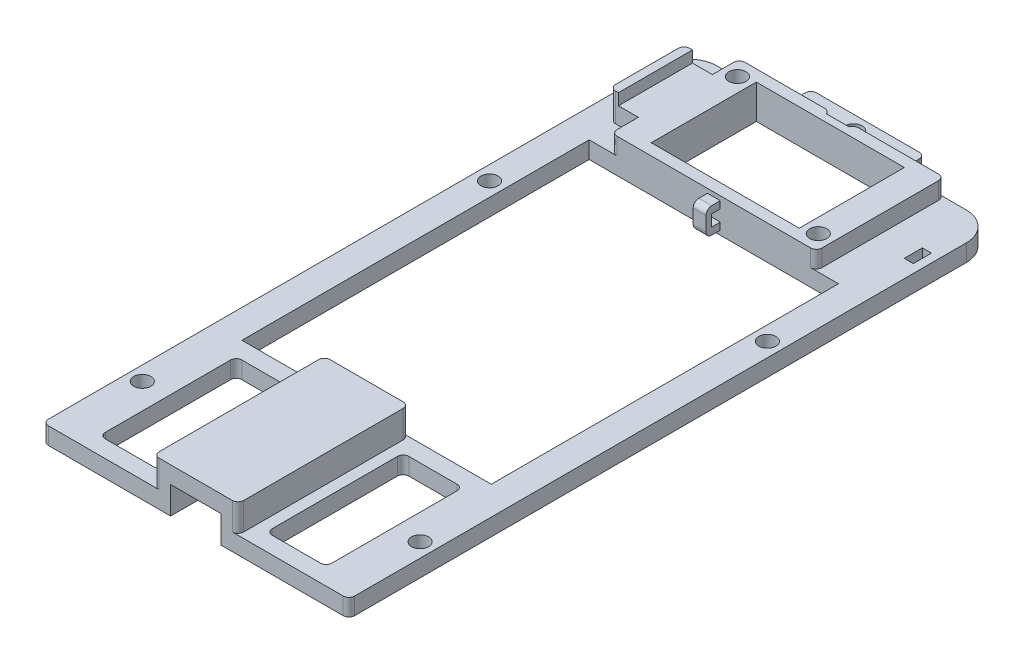
from build123d import *

# Parameters (mm, degrees)
BOSS_EXTRUDE1_DEPTH = 30
BOSS_EXTRUDE2_DEPTH = 3
SKETCH4_W           = 10.48
SKETCH4_H           = 24
CUT_EXTRUDE1_DEPTH  = 93.244717637
SKETCH5_R           = 1.5
CUT_EXTRUDE2_DEPTH  = 93.244717637
FILLET1_R           = 1
SKETCH7_W           = 26
SKETCH7_H           = 18.47
BOSS_EXTRUDE3_DEPTH = 3
SKETCH8_R           = 1.5
CUT_EXTRUDE3_DEPTH  = 4
SKETCH9_W           = 1.5
SKETCH9_H           = 13
BOSS_EXTRUDE4_DEPTH = 2
SKETCH10_W          = 26
SKETCH10_H          = 18.47
CUT_EXTRUDE4_DEPTH  = 3
SKETCH11_W          = 4
SKETCH11_H          = 0.67806633
CUT_EXTRUDE5_DEPTH  = 3
FILLET2_R           = 1
FILLET3_R           = 5
SKETCH12_W          = 1.6
SKETCH12_H          = 3.2
SKETCH12_H_2        = 4.8
CUT_EXTRUDE6_DEPTH  = 3
SKETCH13_W          = 2.25
SKETCH13_H          = 1.25
BOSS_EXTRUDE5_DEPTH = 1.5
SKETCH14_W          = 2.25
SKETCH14_H          = 4.5
BOSS_EXTRUDE6_DEPTH = 1
FILLET4_R           = 1


with BuildPart() as part:
    # Sketch1 → Boss-Extrude1 (new body)
    with BuildSketch(Plane.XY):
        Polygon((-26.9, 2.045135231), (-26.9, 5.045135231), (-7.42, 5.045135231), (-7.42, 9.845135231), (7.42, 9.845135231), (7.42, 5.045135231), (26.9, 5.045135231), (26.9, 2.045135231), (4.42, 2.045135231), (4.42, 6.845135231), (-4.42, 6.845135231), (-4.42, 2.045135231), align=None)
    extrude(amount=BOSS_EXTRUDE1_DEPTH)

    # Sketch3 → Boss-Extrude2 (add)
    with BuildSketch(Plane(origin=(0, 5.045135231, 0), x_dir=(1, 0, 0), z_dir=(0, 1, 0))):
        Polygon((26.9, 0), (26.9, 83.431524331), (10, 83.47), (10, 88.104698694), (-10.074836098, 88.104698694), (-10.074836098, 83.47), (-26.9, 83.47), (-26.9, 0), (-21.9, 0), (-21.9, 61), (21.9, 61), (21.9, 0), align=None)
    extrude(amount=-BOSS_EXTRUDE2_DEPTH)

    # Sketch4 → Cut-Extrude1 (cut, through all)
    with BuildSketch(Plane(origin=(0, 5.045135231, 0), x_dir=(1, 0, 0), z_dir=(0, 1, 0))):
        with Locations((14.66, -15)):
            Rectangle(SKETCH4_W, SKETCH4_H)
        with Locations((-14.66, -15)):
            Rectangle(SKETCH4_W, SKETCH4_H)
    extrude(amount=-CUT_EXTRUDE1_DEPTH, mode=Mode.SUBTRACT)

    # Sketch5 → Cut-Extrude2 (cut, through all)
    with BuildSketch(Plane(origin=(0, 5.045135231, 0), x_dir=(1, 0, 0), z_dir=(0, 1, 0))):
        with Locations(Location((24.4, -15, 0), (0, 0, 270))):
            Circle(SKETCH5_R)
        with Locations(Location((-24.4, -15, 0), (0, 0, 270))):
            Circle(SKETCH5_R)
        with Locations(Location((-0.037418049, 85.604698694, 0), (0, 0, 270))):
            Circle(SKETCH5_R)
        with Locations(Location((24.4, 46, 0), (0, 0, 270))):
            Circle(SKETCH5_R)
        with Locations(Location((-24.4, 46, 0), (0, 0, 270))):
            Circle(SKETCH5_R)
    extrude(amount=-CUT_EXTRUDE2_DEPTH, mode=Mode.SUBTRACT)

    # Fillet1
    fillet1_edges = [part.edges().sort_by_distance(p)[0] for p in [
        (-7.42, 7.445135231, 0),
        (7.42, 7.445135231, 0),
        (26.9, 3.545135231, 30),
        (7.42, 7.445135231, 30),
        (-10.074836098, 3.545135231, -88.104698694),
        (10, 3.545135231, -88.104698694),
        (-7.42, 7.445135231, 30),
        (-26.9, 3.545135231, 30),
        (9.42, 3.545135231, 27),
        (9.42, 3.545135231, 3),
        (19.9, 3.545135231, 3),
        (19.9, 3.545135231, 27),
        (-19.9, 3.545135231, 3),
        (-9.42, 3.545135231, 3),
        (-9.42, 3.545135231, 27),
        (-19.9, 3.545135231, 27),
    ]]
    fillet(fillet1_edges, radius=FILLET1_R)

    # Sketch7 → Boss-Extrude3 (add)
    with BuildSketch(Plane(origin=(0, 5.045135231, 0), x_dir=(1, 0, 0), z_dir=(0, 1, 0))):
        Polygon((-18, 83.47), (-18, 78.74462915), (-23, 78.74462915), (-23, 65.74462915), (-18, 65.74462915), (-18, 61), (18, 61), (18, 83.47), align=None)
        with Locations((0, 72.235)):
            Rectangle(SKETCH7_W, SKETCH7_H, mode=Mode.SUBTRACT)
    extrude(amount=BOSS_EXTRUDE3_DEPTH)

    # Sketch8 → Cut-Extrude3 (cut)
    with BuildSketch(Plane(origin=(0, 8.045135231, 0), x_dir=(1, 0, 0), z_dir=(0, 1, 0))):
        with Locations(Location((-15.5, 80.64462915, 0), (0, 0, 270))):
            Circle(SKETCH8_R)
        with Locations(Location((15.5, 63.84462915, 0), (0, 0, 270))):
            Circle(SKETCH8_R)
    extrude(amount=-CUT_EXTRUDE3_DEPTH, mode=Mode.SUBTRACT)

    # Sketch9 → Boss-Extrude4 (add)
    with BuildSketch(Plane(origin=(0, 8.045135231, 0), x_dir=(1, 0, 0), z_dir=(0, 1, 0))):
        with Locations((-22.25, 72.24462915)):
            Rectangle(SKETCH9_W, SKETCH9_H)
    extrude(amount=BOSS_EXTRUDE4_DEPTH)

    # Sketch10 → Cut-Extrude4 (cut)
    with BuildSketch(Plane(origin=(0, 5.045135231, 0), x_dir=(1, 0, 0), z_dir=(0, 1, 0))):
        with Locations((0, 72.235)):
            Rectangle(SKETCH10_W, SKETCH10_H)
    extrude(amount=-CUT_EXTRUDE4_DEPTH, mode=Mode.SUBTRACT)

    # Sketch11 → Cut-Extrude5 (cut)
    with BuildSketch(Plane(origin=(0, 8.045135231, 0), x_dir=(1, 0, 0), z_dir=(0, 1, 0))):
        with Locations((-0.037418049, 83.130966835)):
            Rectangle(SKETCH11_W, SKETCH11_H)
    extrude(amount=-CUT_EXTRUDE5_DEPTH, mode=Mode.SUBTRACT)

    # Fillet2
    # the kernel refuses this fillet: 1 mm, written as the material it takes off along each edge
    with BuildSketch(Plane(origin=(18, 5.045135231, -83.47), x_dir=(0, 0, 1), z_dir=(0, 1, 0)), Plane(origin=(-18, 5.045135231, -83.47), x_dir=(1, 0, 0), z_dir=(0, 1, 0)), Plane(origin=(-18, 5.045135231, -61), x_dir=(0, 0, -1), z_dir=(0, 1, 0)), Plane(origin=(18, 5.045135231, -61), x_dir=(-1, 0, 0), z_dir=(0, 1, 0))) as fillet2_piece_1:
        with BuildLine():
            CenterArc((FILLET2_R, -FILLET2_R), FILLET2_R, 90, 90)
            Line((0, -FILLET2_R), (-FILLET2_R * 0.02, -FILLET2_R))
            Line((-FILLET2_R * 0.02, -FILLET2_R), (-FILLET2_R * 0.02, FILLET2_R * 0.02))
            Line((-FILLET2_R * 0.02, FILLET2_R * 0.02), (FILLET2_R, FILLET2_R * 0.02))
            Line((FILLET2_R, FILLET2_R * 0.02), (FILLET2_R, 0))
        make_face()
    extrude(amount=5.5, mode=Mode.SUBTRACT)
    with BuildSketch(Plane(origin=(-23, 5.045135231, -78.74462915), x_dir=(1, 0, 0), z_dir=(0, 1, 0)), Plane(origin=(-23, 5.045135231, -65.74462915), x_dir=(0, 0, -1), z_dir=(0, 1, 0))) as fillet2_piece_2:
        with BuildLine():
            CenterArc((FILLET2_R, -FILLET2_R), FILLET2_R, 90, 90)
            Line((0, -FILLET2_R), (-FILLET2_R * 0.02, -FILLET2_R))
            Line((-FILLET2_R * 0.02, -FILLET2_R), (-FILLET2_R * 0.02, FILLET2_R * 0.02))
            Line((-FILLET2_R * 0.02, FILLET2_R * 0.02), (FILLET2_R, FILLET2_R * 0.02))
            Line((FILLET2_R, FILLET2_R * 0.02), (FILLET2_R, 0))
        make_face()
    extrude(amount=7.5, mode=Mode.SUBTRACT)
    with BuildSketch(Plane(origin=(1.962581951, 10.412040795, -83.47), x_dir=(1, 0, 0), z_dir=(0, -1, 0))) as fillet2_piece_3:
        with BuildLine():
            CenterArc((0.946762226, 1), FILLET2_R, 198.779905416, 71.220094584)
            Line((0, 0.67806633), (-0.018935245, 0.671627657))
            ThreePointArc((-0.018935245, 0.671627657), (-0.02, 0.339033165), (-0.02, 0))
            Line((-0.02, 0), (0, -0.02))
            Line((0, -0.02), (0.946762226, -0.02))
            Line((0.946762226, -0.02), (0.946762226, 0))
        make_face()
    extrude(amount=5.366905565, mode=Mode.SUBTRACT)
    with BuildSketch(Plane(origin=(-2.037418049, 10.412040795, -83.47), x_dir=(-1, 0, 0), z_dir=(0, -1, 0))) as fillet2_piece_4:
        with BuildLine():
            CenterArc((0.946762226, -1), FILLET2_R, 90, 71.220094584)
            Line((0, -0.67806633), (-0.018935245, -0.671627657))
            ThreePointArc((-0.018935245, -0.671627657), (-0.02, -0.339033165), (-0.02, 0))
            Line((-0.02, 0), (0, 0.02))
            Line((0, 0.02), (0.946762226, 0.02))
            Line((0.946762226, 0.02), (0.946762226, 0))
        make_face()
    extrude(amount=5.366905565, mode=Mode.SUBTRACT)

    # Fillet3
    fillet3_edges = [part.edges().sort_by_distance(p)[0] for p in [
        (-26.9, 3.545135231, -83.47),
        (26.9, 3.545135231, -83.431524331),
    ]]
    fillet(fillet3_edges, radius=FILLET3_R)

    # Sketch12 → Cut-Extrude6 (cut)
    with BuildSketch(Plane(origin=(0, 5.045135231, 0), x_dir=(1, 0, 0), z_dir=(0, 1, 0))):
        with Locations((24.6, 72.235)):
            Rectangle(SKETCH12_W, SKETCH12_H)
        with Locations((-24.85, 72.235)):
            Rectangle(SKETCH12_W, SKETCH12_H_2)
    extrude(amount=-CUT_EXTRUDE6_DEPTH, mode=Mode.SUBTRACT)

    # Sketch13 → Boss-Extrude5 (add)
    with BuildSketch(Plane.XY.offset(-61)):
        with Locations((0, 6.670135231)):
            Rectangle(SKETCH13_W, SKETCH13_H)
        with Locations((0, 3.420135231)):
            Rectangle(SKETCH13_W, SKETCH13_H)
    extrude(amount=BOSS_EXTRUDE5_DEPTH)

    # Sketch14 → Boss-Extrude6 (add)
    with BuildSketch(Plane.XY.offset(-59.5)):
        with Locations((0, 5.045135231)):
            Rectangle(SKETCH14_W, SKETCH14_H)
    extrude(amount=BOSS_EXTRUDE6_DEPTH)

    # Fillet4
    fillet4_edges = [part.edges().sort_by_distance(p)[0] for p in [
        (0, 2.795135231, -58.5),
        (0, 7.295135231, -58.5),
    ]]
    fillet(fillet4_edges, radius=FILLET4_R)


solid = part.part
